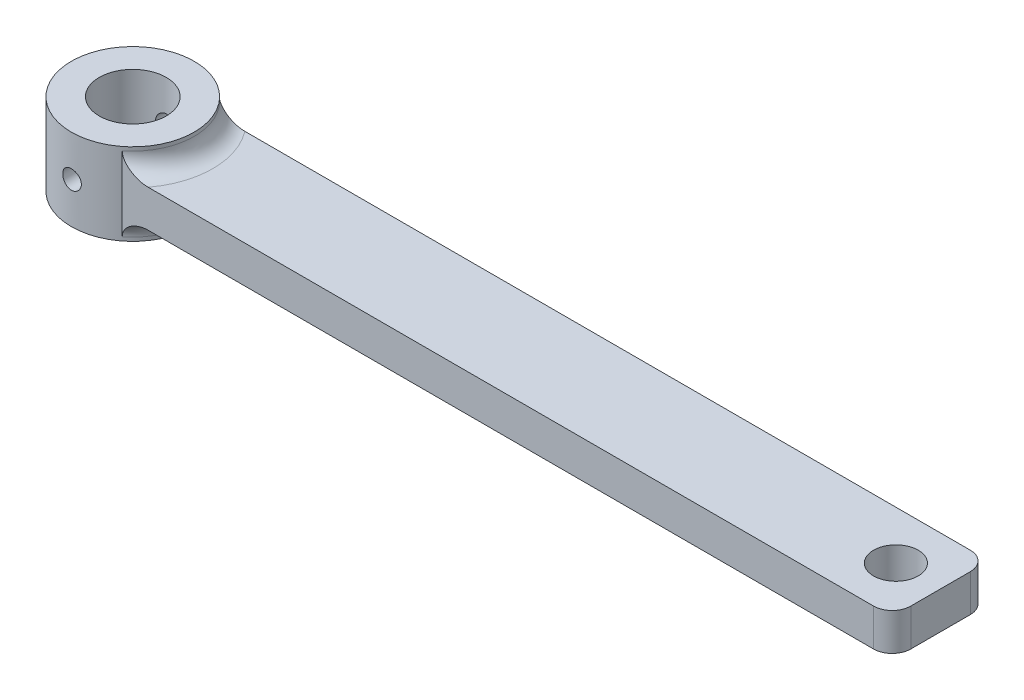
from build123d import *

# Parameters (mm, degrees)
SZKIC1_R                         = 6
DODANIE_WYCI_GNI_CIE1_DEPTH      = 10
DODANIE_WYCI_GNI_CIE2_DEPTH      = 6
DODANIE_WYCI_GNI_CIE2_DEPTH_BACK = 16
SZKIC2_R                         = 16.5
SZKIC3_R                         = 9
WYTNIJ_WYCI_GNI_CIE1_DEPTH       = 221.098273505
WYTNIJ_WYCI_GNI_CIE2_DEPTH       = 220.579712178
WYTNIJ_WYCI_GNI_CIE2_DEPTH_BACK  = 220.579712178
SZKIC4_R                         = 2.5
ZAOKR_GLENIE1_R                  = 5


with BuildPart() as part:
    # Szkic1 → Dodanie-wyciągnięcie1 (new body)
    with BuildSketch(Plane(origin=(0, 0, 0), x_dir=(1, 0, 0), z_dir=(0, 1, 0))):
        with BuildLine():
            Line((0, 0), (212, 0))
            ThreePointArc((212, 0), (215.535533906, 1.464466094), (217, 5))
            Line((217, 5), (217, 21))
            ThreePointArc((217, 21), (215.535533906, 24.535533906), (212, 26))
            Line((212, 26), (0, 26))
            Line((0, 26), (0, 0))
        make_face()
        with Locations(Location((205, 13, 0), (0, 0, 270))):
            Circle(SZKIC1_R, mode=Mode.SUBTRACT)
    extrude(amount=DODANIE_WYCI_GNI_CIE1_DEPTH)

    # Szkic2 → Dodanie-wyciągnięcie2 (add, two sides: drawn at the far end of the back side and taken through both)
    with BuildSketch(Plane(origin=(0, 10, 0), x_dir=(1, 0, 0), z_dir=(0, 1, 0)).offset(-DODANIE_WYCI_GNI_CIE2_DEPTH_BACK)):
        with Locations(Location((0, 13, 0), (0, 0, 270))):
            Circle(SZKIC2_R)
    extrude(amount=DODANIE_WYCI_GNI_CIE2_DEPTH + DODANIE_WYCI_GNI_CIE2_DEPTH_BACK)

    # Szkic3 → Wytnij-wyciągnięcie1 (cut, through all)
    with BuildSketch(Plane(origin=(0, 16, 0), x_dir=(1, 0, 0), z_dir=(0, 1, 0))):
        with Locations(Location((0, 13, 0), (0, 0, 270))):
            Circle(SZKIC3_R)
    extrude(amount=-WYTNIJ_WYCI_GNI_CIE1_DEPTH, mode=Mode.SUBTRACT)

    # Szkic4 → Wytnij-wyciągnięcie2 (cut, two sides: drawn at the far end of the back side and taken through both)
    with BuildSketch(Plane.XY.offset(-WYTNIJ_WYCI_GNI_CIE2_DEPTH_BACK)):
        with Locations((0, 5)):
            Circle(SZKIC4_R)
    extrude(amount=WYTNIJ_WYCI_GNI_CIE2_DEPTH + WYTNIJ_WYCI_GNI_CIE2_DEPTH_BACK, mode=Mode.SUBTRACT)

    # Zaokrąglenie1
    # the kernel refuses this fillet: 5 mm, written as the material it adds along each edge
    with BuildSketch(Plane(origin=(0, 0, -13), x_dir=(-0.09440175808825453, 0, 0.9955341822709287), z_dir=(-0.9955341822709287, 0, -0.09440175808825453))) as zaokr_glenie1_piece_1_section:
        with BuildLine():
            CenterArc((16.5 + ZAOKR_GLENIE1_R, -ZAOKR_GLENIE1_R), ZAOKR_GLENIE1_R, 90, 90)
            Line((16.5, -ZAOKR_GLENIE1_R), (16.5, 0))
            Line((16.5, 0), (16.5 + ZAOKR_GLENIE1_R, 0))
        make_face()
    zaokr_glenie1_piece_1 = revolve(axis=Axis((0, 0, -13), (0, 1, 0)), revolution_arc=190.833776665, mode=Mode.PRIVATE)
    zaokr_glenie1_piece_1 = split(zaokr_glenie1_piece_1, bisect_by=Plane(origin=(17.924039728, -1.424039728, -26), z_dir=(0, 0, 1)), keep=Keep.TOP, mode=Mode.PRIVATE)
    zaokr_glenie1_piece_1 = split(zaokr_glenie1_piece_1, bisect_by=Plane(origin=(17.924039728, -1.424039728, 0), z_dir=(0, 0, -1)), keep=Keep.TOP, mode=Mode.PRIVATE)
    with BuildSketch(Plane(origin=(0, 10, -13), x_dir=(-0.09440175808827972, 0, 0.9955341822709262), z_dir=(-0.9955341822709262, 0, -0.09440175808827972))) as zaokr_glenie1_piece_2_section:
        with BuildLine():
            CenterArc((16.5 + ZAOKR_GLENIE1_R, ZAOKR_GLENIE1_R), ZAOKR_GLENIE1_R, 180, 90)
            Line((16.5, ZAOKR_GLENIE1_R), (16.5, 0))
            Line((16.5, 0), (16.5 + ZAOKR_GLENIE1_R, 0))
        make_face()
    zaokr_glenie1_piece_2 = revolve(axis=Axis((0, 10, -13), (0, 1, 0)), revolution_arc=190.833776665, mode=Mode.PRIVATE)
    zaokr_glenie1_piece_2 = split(zaokr_glenie1_piece_2, bisect_by=Plane(origin=(17.924039728, 11.424039728, -26), z_dir=(0, 0, 1)), keep=Keep.TOP, mode=Mode.PRIVATE)
    zaokr_glenie1_piece_2 = split(zaokr_glenie1_piece_2, bisect_by=Plane(origin=(17.924039728, 11.424039728, 0), z_dir=(0, 0, -1)), keep=Keep.TOP, mode=Mode.PRIVATE)
    add([zaokr_glenie1_piece_1, zaokr_glenie1_piece_2])


solid = part.part
